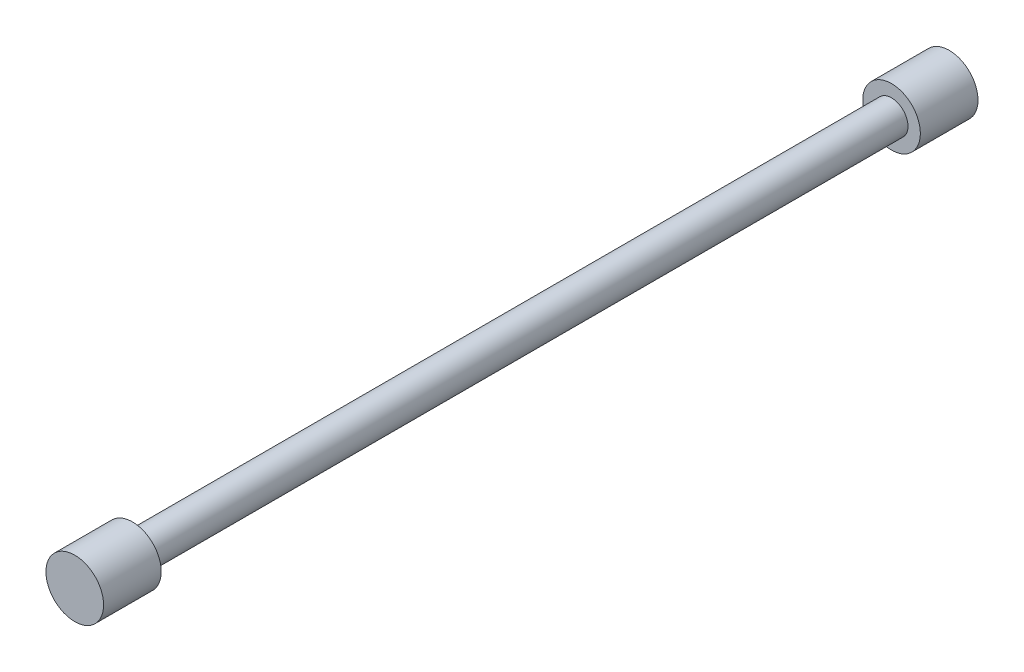
from build123d import *


with BuildPart() as part:
    # SK_Rod → Rod_Body (revolve)
    with BuildSketch(Plane(origin=(0, 0, 0), x_dir=(1, 0, 0), z_dir=(0, 1, 0))):
        Polygon((0, -7), (7, -7), (7, 7), (4, 7), (4, 191.363303058), (7, 191.363303058), (7, 205.363303058), (0, 205.363303058), align=None)
    revolve(axis=Axis((0, 0, 10), (0, 0, -1)))


solid = part.part
